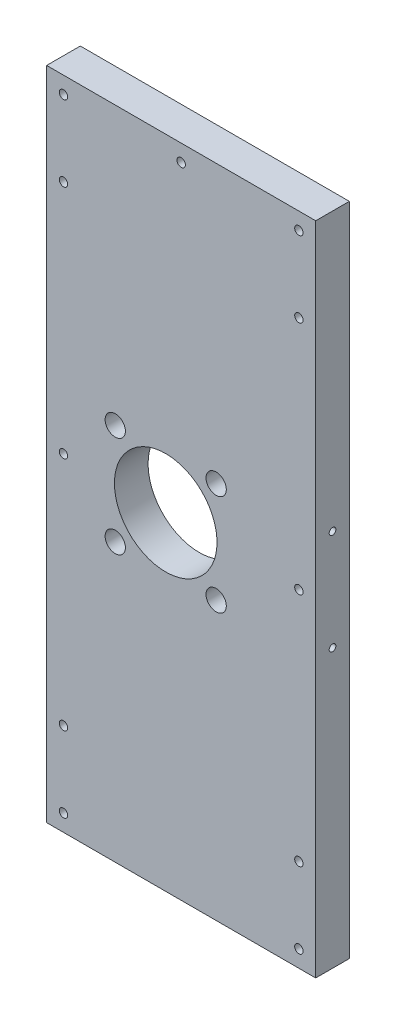
from build123d import *

# Parameters (mm, degrees)
SKIZZE1_W                       = 80
SKIZZE1_H                       = 195
AUFSATZ_LINEAR_AUSTRAGEN1_DEPTH = 10
SKIZZE2_R                       = 3.015
SKIZZE2_R_2                     = 15.25
SCHNITT_LINEAR_AUSTRAGEN1_DEPTH = 10
SKIZZE3_R                       = 2.5
SCHNITT_LINEAR_AUSTRAGEN2_DEPTH = 5
SKIZZE6_R                       = 1.25
SCHNITT_LINEAR_AUSTRAGEN4_DEPTH = 5
SKIZZE7_R                       = 1
SCHNITT_LINEAR_AUSTRAGEN5_DEPTH = 20
SCHNITT_LINEAR_START            = -30
SKIZZE8_R                       = 1
SCHNITT_LINEAR_AUSTRAGEN6_DEPTH = 30


with BuildPart() as part:
    # Skizze1 → Aufsatz-Linear austragen1 (new body)
    with BuildSketch(Plane.XY):
        with Locations((-29.059385344, -27.400468384)):
            Rectangle(SKIZZE1_W, SKIZZE1_H)
    extrude(amount=-AUFSATZ_LINEAR_AUSTRAGEN1_DEPTH)

    # Skizze2 → Schnitt-Linear austragen1 (cut)
    with BuildSketch(Plane(origin=(0, 0, -10), x_dir=(-1, 0, 0), z_dir=(0, 0, -1))):
        with Locations((18.659385344, -12.400468384)):
            Circle(SKIZZE2_R)
        with Locations((48.659385344, -12.400468384)):
            Circle(SKIZZE2_R)
        with Locations((18.659385344, -42.400468384)):
            Circle(SKIZZE2_R)
        with Locations((48.659385344, -42.400468384)):
            Circle(SKIZZE2_R)
        with Locations((33.659385344, -27.400468384)):
            Circle(SKIZZE2_R_2)
    extrude(amount=-SCHNITT_LINEAR_AUSTRAGEN1_DEPTH, mode=Mode.SUBTRACT)

    # Skizze3 → Schnitt-Linear austragen2 (cut)
    with BuildSketch(Plane(origin=(0, 0, -10), x_dir=(-1, 0, 0), z_dir=(0, 0, -1))):
        with Locations((29.059385344, 65.099531616)):
            Circle(SKIZZE3_R)
        with Locations((-5.940614656, 65.099531616)):
            Circle(SKIZZE3_R)
        with Locations((64.059385344, 65.099531616)):
            Circle(SKIZZE3_R)
        with Locations((29.059385344, -119.900468384)):
            Circle(SKIZZE3_R)
        with Locations((-5.940614656, -119.900468384)):
            Circle(SKIZZE3_R)
        with Locations((64.059385344, -119.900468384)):
            Circle(SKIZZE3_R)
        with Locations((-5.940614656, 42.599531616)):
            Circle(SKIZZE3_R)
        with Locations((-5.940614656, -27.400468384)):
            Circle(SKIZZE3_R)
        with Locations((-5.940614656, -97.400468384)):
            Circle(SKIZZE3_R)
        with Locations((64.059385344, -97.400468384)):
            Circle(SKIZZE3_R)
        with Locations((64.059385344, -27.400468384)):
            Circle(SKIZZE3_R)
        with Locations((64.059385344, 42.599531616)):
            Circle(SKIZZE3_R)
    extrude(amount=-SCHNITT_LINEAR_AUSTRAGEN2_DEPTH, mode=Mode.SUBTRACT)

    # Skizze6 → Schnitt-Linear austragen4 (cut)
    with BuildSketch(Plane.XY):
        with Locations((-64.059385344, 65.099531616)):
            Circle(SKIZZE6_R)
        with Locations((-29.059385344, 65.099531616)):
            Circle(SKIZZE6_R)
        with Locations((5.940614656, 65.099531616)):
            Circle(SKIZZE6_R)
        with Locations((-64.059385344, 42.599531616)):
            Circle(SKIZZE6_R)
        with Locations((-64.059385344, -27.400468384)):
            Circle(SKIZZE6_R)
        with Locations((-64.059385344, -97.400468384)):
            Circle(SKIZZE6_R)
        with Locations((-64.059385344, -119.900468384)):
            Circle(SKIZZE6_R)
        with Locations((5.940614656, -119.900468384)):
            Circle(SKIZZE6_R)
        with Locations((5.940614656, -97.400468384)):
            Circle(SKIZZE6_R)
        with Locations((5.940614656, -27.400468384)):
            Circle(SKIZZE6_R)
        with Locations((5.940614656, 42.599531616)):
            Circle(SKIZZE6_R)
    extrude(amount=-SCHNITT_LINEAR_AUSTRAGEN4_DEPTH, mode=Mode.SUBTRACT)

    # Skizze7 → Schnitt-Linear austragen5 (cut)
    with BuildSketch(Plane.ZY.offset(69.059385344)):
        with Locations((-5, -12.400468384)):
            Circle(SKIZZE7_R)
        with Locations((-5, -42.400468384)):
            Circle(SKIZZE7_R)
    extrude(amount=-SCHNITT_LINEAR_AUSTRAGEN5_DEPTH, mode=Mode.SUBTRACT)

    # Skizze8 → Schnitt-Linear austragen6 (cut)
    with BuildSketch(Plane(origin=(10.940614656, 0, 0), x_dir=(0, 0, -1), z_dir=(1, 0, 0)).offset(SCHNITT_LINEAR_START)):
        with Locations((5, -12.400468384)):
            Circle(SKIZZE8_R)
        with Locations((5, -42.400468384)):
            Circle(SKIZZE8_R)
    extrude(amount=SCHNITT_LINEAR_AUSTRAGEN6_DEPTH, mode=Mode.SUBTRACT)


solid = part.part
